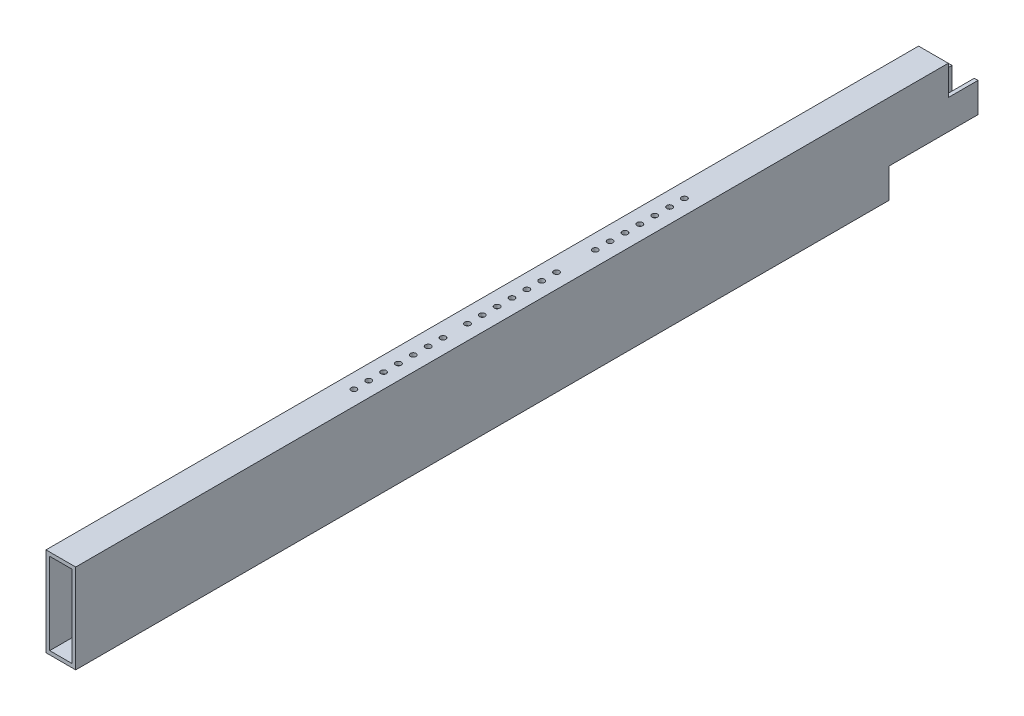
from build123d import *

# Parameters (mm, degrees)
SKETCH1_W           = 25.4
SKETCH1_H           = 76.2
BOSS_EXTRUDE1_DEPTH = 385.699
SHELL1_T            = -3.175
SKETCH2_W           = 76.2
SKETCH2_H           = 25.4
CUT_EXTRUDE1_DEPTH  = 389.407632007
SKETCH3_W           = 25.4
SKETCH3_H           = 25.4
CUT_EXTRUDE2_DEPTH  = 389.407632007
CUT_EXTRUDE3_REACH  = 395.359
SKETCH4_R           = 2.38125


with BuildPart() as part:
    # Sketch1 → Boss-Extrude1 (new, symmetric)
    with BuildSketch(Plane.XY):
        Rectangle(SKETCH1_W, SKETCH1_H)
    extrude(amount=BOSS_EXTRUDE1_DEPTH, both=True)

    # Shell1
    shell1_openings = [part.faces().sort_by_distance(p)[0] for p in [
        (0, 0, -385.699),
        (0, 0, 385.699),
    ]]
    offset(amount=SHELL1_T, openings=shell1_openings, kind=Kind.INTERSECTION)

    # Sketch2 → Cut-Extrude1 (cut, through all)
    with BuildSketch(Plane(origin=(12.7, 0, 0), x_dir=(0, 0, -1), z_dir=(1, 0, 0))):
        with Locations((347.599, -25.4)):
            Rectangle(SKETCH2_W, SKETCH2_H)
    extrude(amount=-CUT_EXTRUDE1_DEPTH, mode=Mode.SUBTRACT)

    # Sketch3 → Cut-Extrude2 (cut, through all)
    with BuildSketch(Plane(origin=(12.7, 0, 0), x_dir=(0, 0, -1), z_dir=(1, 0, 0))):
        with Locations((372.999, 25.4)):
            Rectangle(SKETCH3_W, SKETCH3_H)
    extrude(amount=-CUT_EXTRUDE2_DEPTH, mode=Mode.SUBTRACT)

    # Sketch4 → Cut-Extrude3 (cut, up to next)
    with BuildSketch(Plane(origin=(0, 38.1, 0), x_dir=(1, 0, 0), z_dir=(0, 1, 0)), mode=Mode.PRIVATE) as cut_extrude3_sk1:
        with Locations((0, 147.394483214)):
            Circle(SKETCH4_R)
    cut_extrude3_tool1 = extrude(cut_extrude3_sk1.sketch, amount=-CUT_EXTRUDE3_REACH, mode=Mode.PRIVATE) & part.part
    # Sketch4 → Cut-Extrude3 (cut, up to next)
    with BuildSketch(Plane(origin=(0, 38.1, 0), x_dir=(1, 0, 0), z_dir=(0, 1, 0)), mode=Mode.PRIVATE) as cut_extrude3_sk2:
        with Locations((0, 134.694483214)):
            Circle(SKETCH4_R)
    cut_extrude3_tool2 = extrude(cut_extrude3_sk2.sketch, amount=-CUT_EXTRUDE3_REACH, mode=Mode.PRIVATE) & part.part
    # Sketch4 → Cut-Extrude3 (cut, up to next)
    with BuildSketch(Plane(origin=(0, 38.1, 0), x_dir=(1, 0, 0), z_dir=(0, 1, 0)), mode=Mode.PRIVATE) as cut_extrude3_sk3:
        with Locations((0, 121.994483214)):
            Circle(SKETCH4_R)
    cut_extrude3_tool3 = extrude(cut_extrude3_sk3.sketch, amount=-CUT_EXTRUDE3_REACH, mode=Mode.PRIVATE) & part.part
    # Sketch4 → Cut-Extrude3 (cut, up to next)
    with BuildSketch(Plane(origin=(0, 38.1, 0), x_dir=(1, 0, 0), z_dir=(0, 1, 0)), mode=Mode.PRIVATE) as cut_extrude3_sk4:
        with Locations((0, 109.294483214)):
            Circle(SKETCH4_R)
    cut_extrude3_tool4 = extrude(cut_extrude3_sk4.sketch, amount=-CUT_EXTRUDE3_REACH, mode=Mode.PRIVATE) & part.part
    # Sketch4 → Cut-Extrude3 (cut, up to next)
    with BuildSketch(Plane(origin=(0, 38.1, 0), x_dir=(1, 0, 0), z_dir=(0, 1, 0)), mode=Mode.PRIVATE) as cut_extrude3_sk5:
        with Locations((0, 96.594483214)):
            Circle(SKETCH4_R)
    cut_extrude3_tool5 = extrude(cut_extrude3_sk5.sketch, amount=-CUT_EXTRUDE3_REACH, mode=Mode.PRIVATE) & part.part
    # Sketch4 → Cut-Extrude3 (cut, up to next)
    with BuildSketch(Plane(origin=(0, 38.1, 0), x_dir=(1, 0, 0), z_dir=(0, 1, 0)), mode=Mode.PRIVATE) as cut_extrude3_sk6:
        with Locations((0, 83.894483214)):
            Circle(SKETCH4_R)
    cut_extrude3_tool6 = extrude(cut_extrude3_sk6.sketch, amount=-CUT_EXTRUDE3_REACH, mode=Mode.PRIVATE) & part.part
    # Sketch4 → Cut-Extrude3 (cut, up to next)
    with BuildSketch(Plane(origin=(0, 38.1, 0), x_dir=(1, 0, 0), z_dir=(0, 1, 0)), mode=Mode.PRIVATE) as cut_extrude3_sk7:
        with Locations((0, 71.194483214)):
            Circle(SKETCH4_R)
    cut_extrude3_tool7 = extrude(cut_extrude3_sk7.sketch, amount=-CUT_EXTRUDE3_REACH, mode=Mode.PRIVATE) & part.part
    # Sketch4 → Cut-Extrude3 (cut, up to next)
    with BuildSketch(Plane(origin=(0, 38.1, 0), x_dir=(1, 0, 0), z_dir=(0, 1, 0)), mode=Mode.PRIVATE) as cut_extrude3_sk8:
        with Locations((0, 38.09873)):
            Circle(SKETCH4_R)
    cut_extrude3_tool8 = extrude(cut_extrude3_sk8.sketch, amount=-CUT_EXTRUDE3_REACH, mode=Mode.PRIVATE) & part.part
    # Sketch4 → Cut-Extrude3 (cut, up to next)
    with BuildSketch(Plane(origin=(0, 38.1, 0), x_dir=(1, 0, 0), z_dir=(0, 1, 0)), mode=Mode.PRIVATE) as cut_extrude3_sk9:
        with Locations((0, 25.39873)):
            Circle(SKETCH4_R)
    cut_extrude3_tool9 = extrude(cut_extrude3_sk9.sketch, amount=-CUT_EXTRUDE3_REACH, mode=Mode.PRIVATE) & part.part
    # Sketch4 → Cut-Extrude3 (cut, up to next)
    with BuildSketch(Plane(origin=(0, 38.1, 0), x_dir=(1, 0, 0), z_dir=(0, 1, 0)), mode=Mode.PRIVATE) as cut_extrude3_sk10:
        with Locations((0, 12.69873)):
            Circle(SKETCH4_R)
    cut_extrude3_tool10 = extrude(cut_extrude3_sk10.sketch, amount=-CUT_EXTRUDE3_REACH, mode=Mode.PRIVATE) & part.part
    # Sketch4 → Cut-Extrude3 (cut, up to next)
    with BuildSketch(Plane(origin=(0, 38.1, 0), x_dir=(1, 0, 0), z_dir=(0, 1, 0)), mode=Mode.PRIVATE) as cut_extrude3_sk11:
        with Locations((0, -0.00127)):
            Circle(SKETCH4_R)
    cut_extrude3_tool11 = extrude(cut_extrude3_sk11.sketch, amount=-CUT_EXTRUDE3_REACH, mode=Mode.PRIVATE) & part.part
    # Sketch4 → Cut-Extrude3 (cut, up to next)
    with BuildSketch(Plane(origin=(0, 38.1, 0), x_dir=(1, 0, 0), z_dir=(0, 1, 0)), mode=Mode.PRIVATE) as cut_extrude3_sk12:
        with Locations((0, -12.70127)):
            Circle(SKETCH4_R)
    cut_extrude3_tool12 = extrude(cut_extrude3_sk12.sketch, amount=-CUT_EXTRUDE3_REACH, mode=Mode.PRIVATE) & part.part
    # Sketch4 → Cut-Extrude3 (cut, up to next)
    with BuildSketch(Plane(origin=(0, 38.1, 0), x_dir=(1, 0, 0), z_dir=(0, 1, 0)), mode=Mode.PRIVATE) as cut_extrude3_sk13:
        with Locations((0, -25.40127)):
            Circle(SKETCH4_R)
    cut_extrude3_tool13 = extrude(cut_extrude3_sk13.sketch, amount=-CUT_EXTRUDE3_REACH, mode=Mode.PRIVATE) & part.part
    # Sketch4 → Cut-Extrude3 (cut, up to next)
    with BuildSketch(Plane(origin=(0, 38.1, 0), x_dir=(1, 0, 0), z_dir=(0, 1, 0)), mode=Mode.PRIVATE) as cut_extrude3_sk14:
        with Locations((0, -38.10127)):
            Circle(SKETCH4_R)
    cut_extrude3_tool14 = extrude(cut_extrude3_sk14.sketch, amount=-CUT_EXTRUDE3_REACH, mode=Mode.PRIVATE) & part.part
    # Sketch4 → Cut-Extrude3 (cut, up to next)
    with BuildSketch(Plane(origin=(0, 38.1, 0), x_dir=(1, 0, 0), z_dir=(0, 1, 0)), mode=Mode.PRIVATE) as cut_extrude3_sk15:
        with Locations((0, -58.99324371)):
            Circle(SKETCH4_R)
    cut_extrude3_tool15 = extrude(cut_extrude3_sk15.sketch, amount=-CUT_EXTRUDE3_REACH, mode=Mode.PRIVATE) & part.part
    # Sketch4 → Cut-Extrude3 (cut, up to next)
    with BuildSketch(Plane(origin=(0, 38.1, 0), x_dir=(1, 0, 0), z_dir=(0, 1, 0)), mode=Mode.PRIVATE) as cut_extrude3_sk16:
        with Locations((0, -71.69324371)):
            Circle(SKETCH4_R)
    cut_extrude3_tool16 = extrude(cut_extrude3_sk16.sketch, amount=-CUT_EXTRUDE3_REACH, mode=Mode.PRIVATE) & part.part
    # Sketch4 → Cut-Extrude3 (cut, up to next)
    with BuildSketch(Plane(origin=(0, 38.1, 0), x_dir=(1, 0, 0), z_dir=(0, 1, 0)), mode=Mode.PRIVATE) as cut_extrude3_sk17:
        with Locations((0, -84.39324371)):
            Circle(SKETCH4_R)
    cut_extrude3_tool17 = extrude(cut_extrude3_sk17.sketch, amount=-CUT_EXTRUDE3_REACH, mode=Mode.PRIVATE) & part.part
    # Sketch4 → Cut-Extrude3 (cut, up to next)
    with BuildSketch(Plane(origin=(0, 38.1, 0), x_dir=(1, 0, 0), z_dir=(0, 1, 0)), mode=Mode.PRIVATE) as cut_extrude3_sk18:
        with Locations((0, -97.09324371)):
            Circle(SKETCH4_R)
    cut_extrude3_tool18 = extrude(cut_extrude3_sk18.sketch, amount=-CUT_EXTRUDE3_REACH, mode=Mode.PRIVATE) & part.part
    # Sketch4 → Cut-Extrude3 (cut, up to next)
    with BuildSketch(Plane(origin=(0, 38.1, 0), x_dir=(1, 0, 0), z_dir=(0, 1, 0)), mode=Mode.PRIVATE) as cut_extrude3_sk19:
        with Locations((0, -109.79324371)):
            Circle(SKETCH4_R)
    cut_extrude3_tool19 = extrude(cut_extrude3_sk19.sketch, amount=-CUT_EXTRUDE3_REACH, mode=Mode.PRIVATE) & part.part
    # Sketch4 → Cut-Extrude3 (cut, up to next)
    with BuildSketch(Plane(origin=(0, 38.1, 0), x_dir=(1, 0, 0), z_dir=(0, 1, 0)), mode=Mode.PRIVATE) as cut_extrude3_sk20:
        with Locations((0, -122.49324371)):
            Circle(SKETCH4_R)
    cut_extrude3_tool20 = extrude(cut_extrude3_sk20.sketch, amount=-CUT_EXTRUDE3_REACH, mode=Mode.PRIVATE) & part.part
    # Sketch4 → Cut-Extrude3 (cut, up to next)
    with BuildSketch(Plane(origin=(0, 38.1, 0), x_dir=(1, 0, 0), z_dir=(0, 1, 0)), mode=Mode.PRIVATE) as cut_extrude3_sk21:
        with Locations((0, -135.19324371)):
            Circle(SKETCH4_R)
    cut_extrude3_tool21 = extrude(cut_extrude3_sk21.sketch, amount=-CUT_EXTRUDE3_REACH, mode=Mode.PRIVATE) & part.part
    add(cut_extrude3_tool1.solids().sort_by_distance((0, 38.1, -147.394483))[0], mode=Mode.SUBTRACT)
    add(cut_extrude3_tool2.solids().sort_by_distance((0, 38.1, -134.694483))[0], mode=Mode.SUBTRACT)
    add(cut_extrude3_tool3.solids().sort_by_distance((0, 38.1, -121.994483))[0], mode=Mode.SUBTRACT)
    add(cut_extrude3_tool4.solids().sort_by_distance((0, 38.1, -109.294483))[0], mode=Mode.SUBTRACT)
    add(cut_extrude3_tool5.solids().sort_by_distance((0, 38.1, -96.594483))[0], mode=Mode.SUBTRACT)
    add(cut_extrude3_tool6.solids().sort_by_distance((0, 38.1, -83.894483))[0], mode=Mode.SUBTRACT)
    add(cut_extrude3_tool7.solids().sort_by_distance((0, 38.1, -71.194483))[0], mode=Mode.SUBTRACT)
    add(cut_extrude3_tool8.solids().sort_by_distance((0, 38.1, -38.09873))[0], mode=Mode.SUBTRACT)
    add(cut_extrude3_tool9.solids().sort_by_distance((0, 38.1, -25.39873))[0], mode=Mode.SUBTRACT)
    add(cut_extrude3_tool10.solids().sort_by_distance((0, 38.1, -12.69873))[0], mode=Mode.SUBTRACT)
    add(cut_extrude3_tool11.solids().sort_by_distance((0, 38.1, 0.00127))[0], mode=Mode.SUBTRACT)
    add(cut_extrude3_tool12.solids().sort_by_distance((0, 38.1, 12.70127))[0], mode=Mode.SUBTRACT)
    add(cut_extrude3_tool13.solids().sort_by_distance((0, 38.1, 25.40127))[0], mode=Mode.SUBTRACT)
    add(cut_extrude3_tool14.solids().sort_by_distance((0, 38.1, 38.10127))[0], mode=Mode.SUBTRACT)
    add(cut_extrude3_tool15.solids().sort_by_distance((0, 38.1, 58.993244))[0], mode=Mode.SUBTRACT)
    add(cut_extrude3_tool16.solids().sort_by_distance((0, 38.1, 71.693244))[0], mode=Mode.SUBTRACT)
    add(cut_extrude3_tool17.solids().sort_by_distance((0, 38.1, 84.393244))[0], mode=Mode.SUBTRACT)
    add(cut_extrude3_tool18.solids().sort_by_distance((0, 38.1, 97.093244))[0], mode=Mode.SUBTRACT)
    add(cut_extrude3_tool19.solids().sort_by_distance((0, 38.1, 109.793244))[0], mode=Mode.SUBTRACT)
    add(cut_extrude3_tool20.solids().sort_by_distance((0, 38.1, 122.493244))[0], mode=Mode.SUBTRACT)
    add(cut_extrude3_tool21.solids().sort_by_distance((0, 38.1, 135.193244))[0], mode=Mode.SUBTRACT)


solid = part.part
